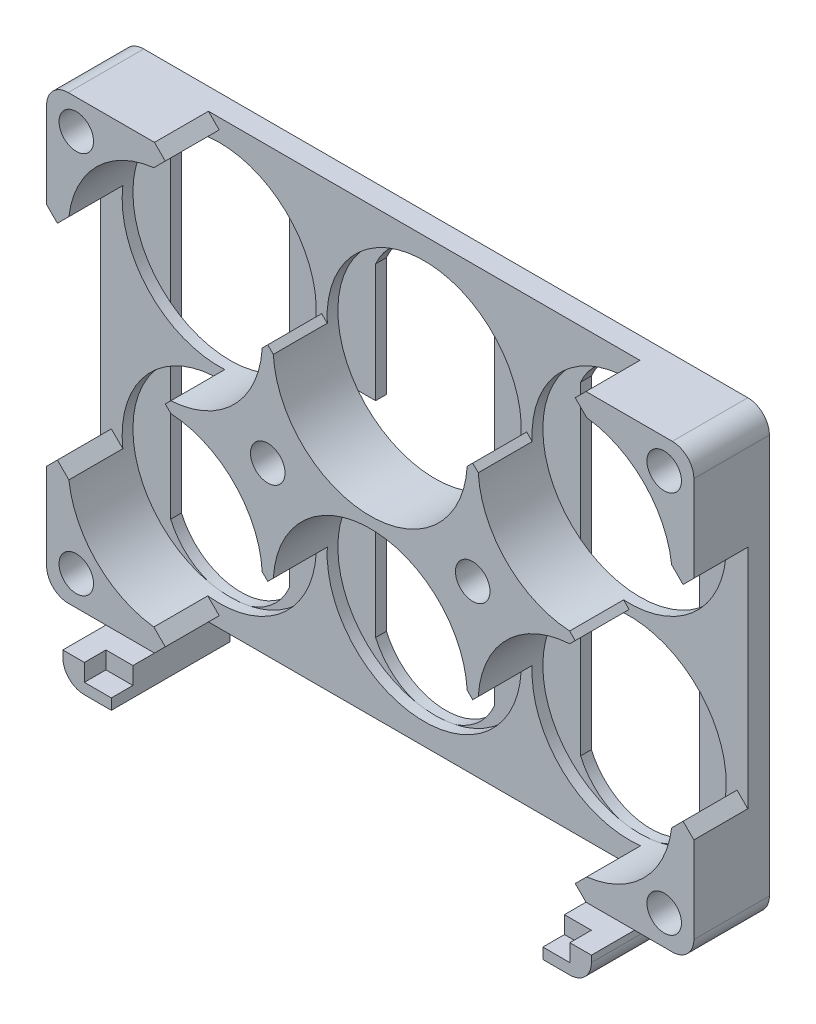
from build123d import *
from build123d.topology import SkipClean

# Parameters (mm, degrees)
SKETCH1_W           = 60
SKETCH1_H           = 41
BOSS_EXTRUDE1_DEPTH = 2
SKETCH2_R           = 9
CUT_EXTRUDE1_DEPTH  = 1
CUT_EXTRUDE2_DEPTH  = 1
SKETCH4_W           = 8
SKETCH4_H           = 8
CUT_EXTRUDE3_DEPTH  = 1
BOSS_EXTRUDE2_START = 5
BOSS_EXTRUDE2_DEPTH = 5
SKETCH6_R           = 1.6
CUT_EXTRUDE4_DEPTH  = 74.006848994
CHAMFER1_SIZE       = 1
CHAMFER2_SIZE       = 0.5
CHAMFER3_SIZE       = 1
FILLET1_R           = 2
BOSS_EXTRUDE3_DEPTH = 2.6
SKETCH8_W           = 2.5
SKETCH8_H           = 1
BOSS_EXTRUDE4_DEPTH = 5
FILLET2_R           = 2
BOSS_EXTRUDE5_START = 4
BOSS_EXTRUDE5_DEPTH = 4
SKETCH10_W          = 2.5
SKETCH10_H          = 7
BOSS_EXTRUDE6_DEPTH = 1.6


with BuildPart() as part:
    # Sketch1 → Boss-Extrude1 (new body)
    with BuildSketch(Plane.XY):
        with Locations((-30, 20.5)):
            Rectangle(SKETCH1_W, SKETCH1_H)
    extrude(amount=BOSS_EXTRUDE1_DEPTH)

    # Sketch2 → Cut-Extrude1 (cut)
    with BuildSketch(Plane.XY.offset(2)):
        with Locations((-49, 11)):
            Circle(SKETCH2_R)
        with Locations((-30, 11)):
            Circle(SKETCH2_R)
        with Locations((-11, 11)):
            Circle(SKETCH2_R)
        with Locations((-30, 30)):
            Circle(SKETCH2_R)
        with Locations((-11, 30)):
            Circle(SKETCH2_R)
        with Locations((-49, 30)):
            Circle(SKETCH2_R)
    extrude(amount=-CUT_EXTRUDE1_DEPTH, mode=Mode.SUBTRACT)

    # Sketch3 → Cut-Extrude2 (cut)
    with BuildSketch(Plane(origin=(0, 0, 0), x_dir=(-1, 0, 0), z_dir=(0, 0, -1))):
        with BuildLine():
            Line((54.5, 35.497915762), (54.5, 5.497915762))
            ThreePointArc((54.5, 5.497915762), (49, 1.895831523), (43.5, 5.497915762))
            Line((43.5, 5.497915762), (43.5, 35.497915762))
            ThreePointArc((43.5, 35.497915762), (49, 39.1), (54.5, 35.497915762))
        make_face()
        with BuildLine():
            Line((35.5, 35.497915762), (35.5, 5.497915762))
            ThreePointArc((35.5, 5.497915762), (30, 1.895831523), (24.5, 5.497915762))
            Line((24.5, 5.497915762), (24.5, 35.497915762))
            ThreePointArc((24.5, 35.497915762), (30, 39.1), (35.5, 35.497915762))
        make_face()
        with BuildLine():
            Line((16.5, 35.497915762), (16.5, 5.497915762))
            ThreePointArc((16.5, 5.497915762), (11, 1.895831523), (5.5, 5.497915762))
            Line((5.5, 5.497915762), (5.5, 35.497915762))
            ThreePointArc((5.5, 35.497915762), (11, 39.1), (16.5, 35.497915762))
        make_face()
    extrude(amount=-CUT_EXTRUDE2_DEPTH, mode=Mode.SUBTRACT)

    # Sketch4 → Cut-Extrude3 (cut)
    with BuildSketch(Plane(origin=(0, 0, 0), x_dir=(-1, 0, 0), z_dir=(0, 0, -1))):
        with Locations((39.5, 20.506096576)):
            Rectangle(SKETCH4_W, SKETCH4_H)
    extrude(amount=-CUT_EXTRUDE3_DEPTH, mode=Mode.SUBTRACT)

    # Sketch5 → Boss-Extrude2 (add)
    with SkipClean():  # the faces are left unmerged after this step: merging them gives an invalid solid
        with BuildSketch(Plane.XY.offset(2).offset(BOSS_EXTRUDE2_START)):
            with BuildLine():
                Line((-49, 20), (-49, 21))
                ThreePointArc((-49, 21), (-42.636038969, 23.636038969), (-40, 30))
                Line((-40, 30), (-39, 30))
                ThreePointArc((-39, 30), (-36.363961031, 23.636038969), (-30, 21))
                ThreePointArc((-30, 21), (-23.636038969, 23.636038969), (-21, 30))
                Line((-21, 30), (-20, 30))
                ThreePointArc((-20, 30), (-17.363961031, 23.636038969), (-11, 21))
                Line((-11, 21), (-11, 20))
                ThreePointArc((-11, 20), (-17.363961031, 17.363961031), (-20, 11))
                Line((-20, 11), (-21, 11))
                ThreePointArc((-21, 11), (-23.636038969, 17.363961031), (-30, 20))
                ThreePointArc((-30, 20), (-36.363961031, 17.363961031), (-39, 11))
                Line((-39, 11), (-40, 11))
                ThreePointArc((-40, 11), (-42.636038969, 17.363961031), (-49, 20))
            make_face()
            with BuildLine():
                Line((-2, 30), (0, 30))
                Line((0, 30), (0, 41))
                Line((0, 41), (-11, 41))
                Line((-11, 41), (-11, 39))
                ThreePointArc((-11, 39), (-4.636038969, 36.363961031), (-2, 30))
            make_face()
            with BuildLine():
                Line((-2, 11), (0, 11))
                Line((0, 11), (0, 0))
                Line((0, 0), (-11, 0))
                Line((-11, 0), (-11, 2))
                ThreePointArc((-11, 2), (-4.636038969, 4.636038969), (-2, 11))
            make_face()
            with BuildLine():
                Line((-49, 2), (-49, 0))
                Line((-49, 0), (-60, 0))
                Line((-60, 0), (-60, 11))
                Line((-60, 11), (-58, 11))
                ThreePointArc((-58, 11), (-55.363961031, 4.636038969), (-49, 2))
            make_face()
            with BuildLine():
                Line((-58, 30), (-60, 30))
                Line((-60, 30), (-60, 41))
                Line((-60, 41), (-49, 41))
                Line((-49, 41), (-49, 39))
                ThreePointArc((-49, 39), (-55.363961031, 36.363961031), (-58, 30))
            make_face()
        extrude(amount=-BOSS_EXTRUDE2_DEPTH)

    # Sketch6 → Cut-Extrude4 (cut, through all)
    with SkipClean():  # the faces are left unmerged after this step: merging them gives an invalid solid
        with BuildSketch(Plane.XY.offset(7)):
            with Locations((-39.5, 20.5)):
                Circle(SKETCH6_R)
            with Locations((-20.5, 20.5)):
                Circle(SKETCH6_R)
            with Locations((-2.75, 2.75)):
                Circle(SKETCH6_R)
            with Locations((-2.75, 38.25)):
                Circle(SKETCH6_R)
            with Locations((-57.25, 38.25)):
                Circle(SKETCH6_R)
            with Locations((-57.25, 2.75)):
                Circle(SKETCH6_R)
        extrude(amount=-CUT_EXTRUDE4_DEPTH, mode=Mode.SUBTRACT)

    # Chamfer1
    chamfer1_edges = [part.edges().sort_by_distance(p)[0] for p in [
        (-22.1, 20.5, 0),
        (-41.1, 20.5, 1),
    ]]
    chamfer(chamfer1_edges, length=CHAMFER1_SIZE)

    # Chamfer2
    # the kernel refuses this chamfer: 0.5 mm, written as the material it takes off along each edge
    with BuildSketch(Plane(origin=(-39, 30, 8.324152825), x_dir=(-1, 0, 0), z_dir=(0, 0, -1)), Plane(origin=(-49, 21, 8.324152825), x_dir=(0, -1, 0), z_dir=(0, 0, -1)), Plane(origin=(-40, 11, 8.324152825), x_dir=(1, 0, 0), z_dir=(0, 0, -1)), Plane(origin=(-21, 11, 8.324152825), x_dir=(1, 0, 0), z_dir=(0, 0, -1)), Plane(origin=(-11, 20, 8.324152825), x_dir=(0, 1, 0), z_dir=(0, 0, -1)), Plane(origin=(-20, 30, 8.324152825), x_dir=(-1, 0, 0), z_dir=(0, 0, -1))) as chamfer2_piece_1:
        with BuildLine():
            Line((CHAMFER2_SIZE, 0), (-0.014731413, -0.514731413))
            ThreePointArc((-0.014731413, -0.514731413), (-0.003894786, -0.264747015), (0, 0))
            Line((0, 0), (CHAMFER2_SIZE, 0))
        make_face()
    extrude(amount=6.324152825, mode=Mode.SUBTRACT)
    with BuildSketch(Plane(origin=(-40, 30, 8.324152825), x_dir=(1, 0, 0), z_dir=(0, 0, -1)), Plane(origin=(-49, 20, 8.324152825), x_dir=(0, 1, 0), z_dir=(0, 0, -1)), Plane(origin=(-39, 11, 8.324152825), x_dir=(-1, 0, 0), z_dir=(0, 0, -1)), Plane(origin=(-20, 11, 8.324152825), x_dir=(-1, 0, 0), z_dir=(0, 0, -1)), Plane(origin=(-11, 21, 8.324152825), x_dir=(0, -1, 0), z_dir=(0, 0, -1)), Plane(origin=(-21, 30, 8.324152825), x_dir=(1, 0, 0), z_dir=(0, 0, -1))) as chamfer2_piece_2:
        with BuildLine():
            Line((CHAMFER2_SIZE, 0), (-0.014731413, 0.514731413))
            ThreePointArc((-0.014731413, 0.514731413), (-0.003894786, 0.264747015), (0, 0))
            Line((0, 0), (CHAMFER2_SIZE, 0))
        make_face()
    extrude(amount=6.324152825, mode=Mode.SUBTRACT)

    # Chamfer3
    # the kernel refuses this chamfer: 1 mm, written as the material it takes off along each edge
    with BuildSketch(Plane(origin=(-49, 39, 9.73772815), x_dir=(0, 1, 0), z_dir=(0, 0, -1)), Plane(origin=(-2, 30, 9.73772815), x_dir=(1, 0, 0), z_dir=(0, 0, -1)), Plane(origin=(-11, 2, 9.73772815), x_dir=(0, -1, 0), z_dir=(0, 0, -1)), Plane(origin=(-58, 11, 9.73772815), x_dir=(-1, 0, 0), z_dir=(0, 0, -1))) as chamfer3_piece_1:
        with BuildLine():
            Line((CHAMFER3_SIZE, 0), (-0.062996063, -1.062996063))
            ThreePointArc((-0.062996063, -1.062996063), (-0.016662827, -0.547405922), (0, 0))
            Line((0, 0), (CHAMFER3_SIZE, 0))
        make_face()
    extrude(amount=7.73772815, mode=Mode.SUBTRACT)
    with BuildSketch(Plane(origin=(-49, 41, 9.571682988), x_dir=(-1, 0, 0), z_dir=(0, 0, -1)), Plane(origin=(0, 30, 9.571682988), x_dir=(0, 1, 0), z_dir=(0, 0, -1)), Plane(origin=(-11, 0, 9.571682988), x_dir=(1, 0, 0), z_dir=(0, 0, -1)), Plane(origin=(-60, 11, 9.571682988), x_dir=(0, -1, 0), z_dir=(0, 0, -1))) as chamfer3_piece_2:
        Polygon((CHAMFER3_SIZE, 0), (0, -CHAMFER3_SIZE), (0, 0), align=None)
    extrude(amount=7.571682988, mode=Mode.SUBTRACT)
    with BuildSketch(Plane(origin=(-11, 39, 9.73772815), x_dir=(0, 1, 0), z_dir=(0, 0, -1)), Plane(origin=(-2, 11, 9.73772815), x_dir=(1, 0, 0), z_dir=(0, 0, -1)), Plane(origin=(-49, 2, 9.73772815), x_dir=(0, -1, 0), z_dir=(0, 0, -1)), Plane(origin=(-58, 30, 9.73772815), x_dir=(-1, 0, 0), z_dir=(0, 0, -1))) as chamfer3_piece_3:
        with BuildLine():
            Line((CHAMFER3_SIZE, 0), (-0.062996063, 1.062996063))
            ThreePointArc((-0.062996063, 1.062996063), (-0.016662827, 0.547405922), (0, 0))
            Line((0, 0), (CHAMFER3_SIZE, 0))
        make_face()
    extrude(amount=7.73772815, mode=Mode.SUBTRACT)
    with BuildSketch(Plane(origin=(-11, 41, 9.571682988), x_dir=(1, 0, 0), z_dir=(0, 0, -1)), Plane(origin=(0, 11, 9.571682988), x_dir=(0, -1, 0), z_dir=(0, 0, -1)), Plane(origin=(-49, 0, 9.571682988), x_dir=(-1, 0, 0), z_dir=(0, 0, -1)), Plane(origin=(-60, 30, 9.571682988), x_dir=(0, 1, 0), z_dir=(0, 0, -1))) as chamfer3_piece_4:
        Polygon((CHAMFER3_SIZE, 0), (0, CHAMFER3_SIZE), (0, 0), align=None)
    extrude(amount=7.571682988, mode=Mode.SUBTRACT)

    # Fillet1
    fillet1_edges = [part.edges().sort_by_distance(p)[0] for p in [
        (0, 0, 3.5),
        (-60, 0, 3.5),
        (-60, 41, 3.5),
        (0, 41, 3.5),
    ]]
    fillet(fillet1_edges, radius=FILLET1_R)

    # Sketch7 → Boss-Extrude3 (add)
    with BuildSketch(Plane(origin=(0, 0, 0), x_dir=(-1, 0, 0), z_dir=(0, -1, 0))):
        Polygon((5.5, -7), (7.5, -7), (7.5, -2), (10, -2), (10, 0), (7.5, 0), (5.5, 0), align=None)
        Polygon((50, 0), (52.5, 0), (54.5, 0), (54.5, -7), (52.5, -7), (52.5, -2), (50, -2), align=None)
    extrude(amount=BOSS_EXTRUDE3_DEPTH)

    # Sketch8 → Boss-Extrude4 (add)
    with BuildSketch(Plane.XY.offset(2)):
        with Locations((-8.75, -2.1)):
            Rectangle(SKETCH8_W, SKETCH8_H)
        with Locations((-51.25, -2.1)):
            Rectangle(SKETCH8_W, SKETCH8_H)
    extrude(amount=BOSS_EXTRUDE4_DEPTH)

    # Fillet2
    fillet2_edges = [part.edges().sort_by_distance(p)[0] for p in [
        (-5.5, -2.6, 3.5),
        (-54.5, -2.6, 3.5),
    ]]
    fillet(fillet2_edges, radius=FILLET2_R)

    # Sketch9 → Boss-Extrude5 (add)
    with BuildSketch(Plane.XY.offset(7).offset(BOSS_EXTRUDE5_START)):
        with BuildLine():
            Line((-5.5, 0), (-7.5, 0))
            Line((-7.5, 0), (-7.5, -1.6))
            Line((-7.5, -1.6), (-10, -1.6))
            Line((-10, -1.6), (-10, -2.6))
            Line((-10, -2.6), (-7.5, -2.6))
            ThreePointArc((-7.5, -2.6), (-6.085786438, -2.014213562), (-5.5, -0.6))
            Line((-5.5, -0.6), (-5.5, 0))
        make_face()
        with BuildLine():
            ThreePointArc((-52.5, -2.6), (-53.914213562, -2.014213562), (-54.5, -0.6))
            Line((-54.5, -0.6), (-54.5, 0))
            Line((-54.5, 0), (-52.5, 0))
            Line((-52.5, 0), (-52.5, -1.6))
            Line((-52.5, -1.6), (-50, -1.6))
            Line((-50, -1.6), (-50, -2.6))
            Line((-50, -2.6), (-52.5, -2.6))
        make_face()
    extrude(amount=-BOSS_EXTRUDE5_DEPTH)

    # Sketch10 → Boss-Extrude6 (add)
    with BuildSketch(Plane(origin=(0, -1.6, 0), x_dir=(1, 0, 0), z_dir=(0, 1, 0))):
        with Locations((-8.75, -5.5)):
            Rectangle(SKETCH10_W, SKETCH10_H)
        with Locations((-51.25, -5.5)):
            Rectangle(SKETCH10_W, SKETCH10_H)
    extrude(amount=BOSS_EXTRUDE6_DEPTH)


solid = part.part
